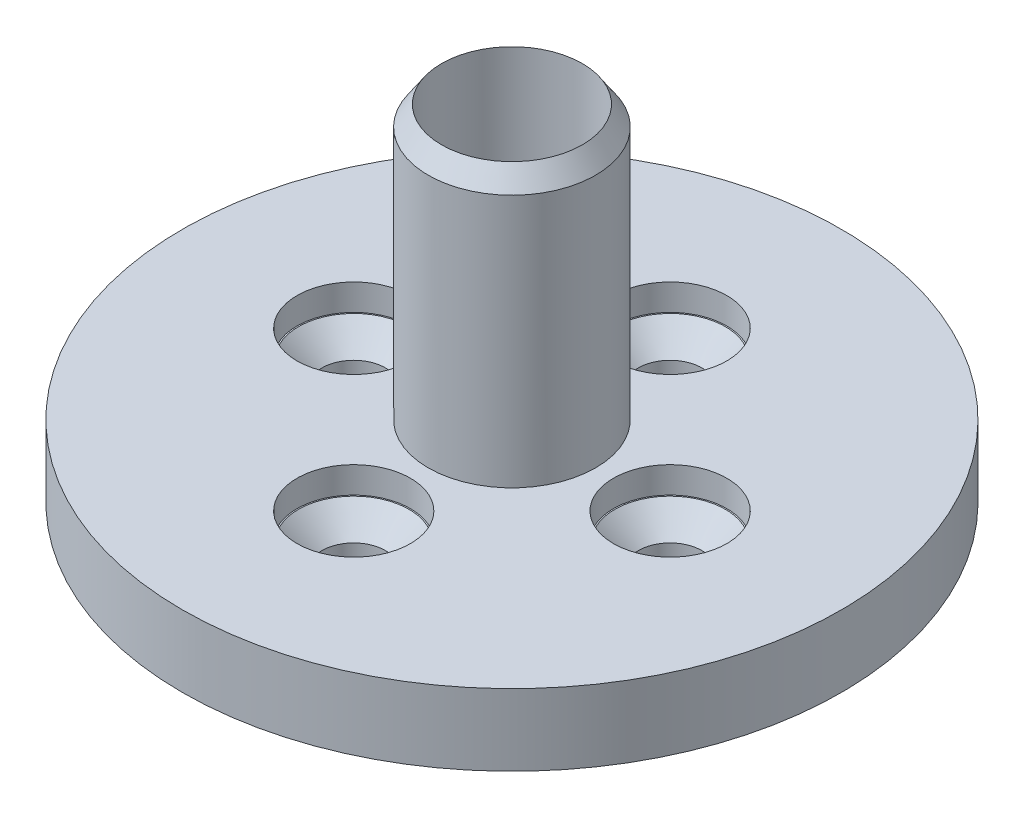
from build123d import *

# Parameters (mm, degrees)
SKETCH1_R           = 12.5
SKETCH1_R_2         = 2.37125
SKETCH1_R_3         = 1.2
BOSS_EXTRUDE1_DEPTH = 2.715
SKETCH2_R           = 2.15
SKETCH2_R_2         = 3.175
CUT_EXTRUDE1_DEPTH  = 1
CHAMFER1_SIZE       = 0.9
SKETCH3_R           = 3.175
SKETCH3_R_2         = 2.37125
BOSS_EXTRUDE2_DEPTH = 13.81
CUT_EXTRUDE2_START  = -13.81
SKETCH4_R           = 2.67125
SKETCH4_R_2         = 2.37125
CUT_EXTRUDE2_DEPTH  = 13.81
CHAMFER2_SIZE       = 1.482560969
CHAMFER2_SIZE_2     = 1


with BuildPart() as part:
    # Sketch1 → Boss-Extrude1 (new body)
    with BuildSketch(Plane(origin=(0, 0, 0), x_dir=(1, 0, 0), z_dir=(0, 1, 0))):
        with Locations(Location((0, 0, 0), (0, 0, 270))):
            Circle(SKETCH1_R)
        with Locations(Location((0, 0, 0), (0, 0, 270))):
            Circle(SKETCH1_R_2, mode=Mode.SUBTRACT)
        with Locations(Location((0, -6, 0), (0, 0, 270))):
            Circle(SKETCH1_R_3, mode=Mode.SUBTRACT)
        with Locations(Location((-6, 0, 0), (0, 0, 270))):
            Circle(SKETCH1_R_3, mode=Mode.SUBTRACT)
        with Locations(Location((0, 6, 0), (0, 0, 270))):
            Circle(SKETCH1_R_3, mode=Mode.SUBTRACT)
        with Locations(Location((6, 0, 0), (0, 0, 270))):
            Circle(SKETCH1_R_3, mode=Mode.SUBTRACT)
    extrude(amount=BOSS_EXTRUDE1_DEPTH)

    # Sketch2 → Cut-Extrude1 (cut)
    with BuildSketch(Plane(origin=(0, 2.715, 0), x_dir=(1, 0, 0), z_dir=(0, 1, 0))):
        with Locations(Location((0, 6, 0), (0, 0, 270))):
            Circle(SKETCH2_R)
        with Locations(Location((-6, 0, 0), (0, 0, 270))):
            Circle(SKETCH2_R)
        with Locations(Location((6, 0, 0), (0, 0, 270))):
            Circle(SKETCH2_R)
        with Locations(Location((0, -6, 0), (0, 0, 270))):
            Circle(SKETCH2_R)
        with Locations(Location((0, 0, 0), (0, 0, 270))):
            Circle(SKETCH2_R_2)
    extrude(amount=-CUT_EXTRUDE1_DEPTH, mode=Mode.SUBTRACT)

    # Chamfer1
    # the kernel refuses this chamfer: 0.9 mm, written as the material it takes off along each edge
    with BuildSketch(Plane(origin=(0, 1.715, 6), x_dir=(0, 0, 1), z_dir=(1, 0, 0))) as chamfer1_piece_1:
        Polygon((1.2, CHAMFER1_SIZE), (1.2 + CHAMFER1_SIZE, 0), (1.2, 0), align=None)
    revolve(axis=Axis((0, 1.715, 6), (0, -1, 0)), mode=Mode.SUBTRACT)
    with BuildSketch(Plane(origin=(6, 1.715, 0), x_dir=(0, 0, 1), z_dir=(1, 0, 0))) as chamfer1_piece_2:
        Polygon((1.2, CHAMFER1_SIZE), (1.2 + CHAMFER1_SIZE, 0), (1.2, 0), align=None)
    revolve(axis=Axis((6, 1.715, 0), (0, -1, 0)), mode=Mode.SUBTRACT)
    with BuildSketch(Plane(origin=(0, 1.715, 0), x_dir=(0, 0, 1), z_dir=(1, 0, 0))) as chamfer1_piece_3_section:
        Polygon((2.37125, CHAMFER1_SIZE), (2.37125 + CHAMFER1_SIZE, 0), (2.37125, 0), align=None)
    chamfer1_piece_3 = revolve(axis=Axis((0, 1.715, 0), (0, -1, 0)), mode=Mode.PRIVATE)
    chamfer1_piece_3 = chamfer1_piece_3 & Plane(origin=(0, 1.217857085, 0), x_dir=(0, 0, 1), z_dir=(0, 1, 0)) * Cylinder(3.175, 14, mode=Mode.PRIVATE)
    add(chamfer1_piece_3, mode=Mode.SUBTRACT)
    with BuildSketch(Plane(origin=(-6, 1.715, 0), x_dir=(0, 0, 1), z_dir=(1, 0, 0))) as chamfer1_piece_4:
        Polygon((1.2, CHAMFER1_SIZE), (1.2 + CHAMFER1_SIZE, 0), (1.2, 0), align=None)
    revolve(axis=Axis((-6, 1.715, 0), (0, -1, 0)), mode=Mode.SUBTRACT)
    with BuildSketch(Plane(origin=(0, 1.715, -6), x_dir=(0, 0, 1), z_dir=(1, 0, 0))) as chamfer1_piece_5:
        Polygon((1.2, CHAMFER1_SIZE), (1.2 + CHAMFER1_SIZE, 0), (1.2, 0), align=None)
    revolve(axis=Axis((0, 1.715, -6), (0, -1, 0)), mode=Mode.SUBTRACT)

    # Sketch3 → Boss-Extrude2 (add)
    with BuildSketch(Plane.XZ):
        with Locations(Location((0, 0, 0), (0, 0, 270))):
            Circle(SKETCH3_R)
        with Locations(Location((0, 0, 0), (0, 0, 270))):
            Circle(SKETCH3_R_2, mode=Mode.SUBTRACT)
    extrude(amount=-BOSS_EXTRUDE2_DEPTH)

    # Sketch4 → Cut-Extrude2 (cut)
    with BuildSketch(Plane(origin=(0, 13.81, 0), x_dir=(1, 0, 0), z_dir=(0, 1, 0)).offset(CUT_EXTRUDE2_START)):
        with Locations(Location((0, 0, 0), (0, 0, 270))):
            Circle(SKETCH4_R)
        Circle(SKETCH4_R_2, mode=Mode.SUBTRACT)
    extrude(amount=CUT_EXTRUDE2_DEPTH, mode=Mode.SUBTRACT)

    # Chamfer2
    # the kernel refuses this chamfer: 1.482560969, 1 mm, written as the material it takes off along each edge
    with BuildSketch(Plane(origin=(0, 13.81, 0), x_dir=(0, 0, -1), z_dir=(-1, 0, 0))) as chamfer2_piece_1:
        Polygon((3.175, CHAMFER2_SIZE), (3.175 - CHAMFER2_SIZE_2, 0), (3.175, 0), align=None)
    revolve(axis=Axis((0, 13.81, 0), (0, -1, 0)), mode=Mode.SUBTRACT)


solid = part.part
